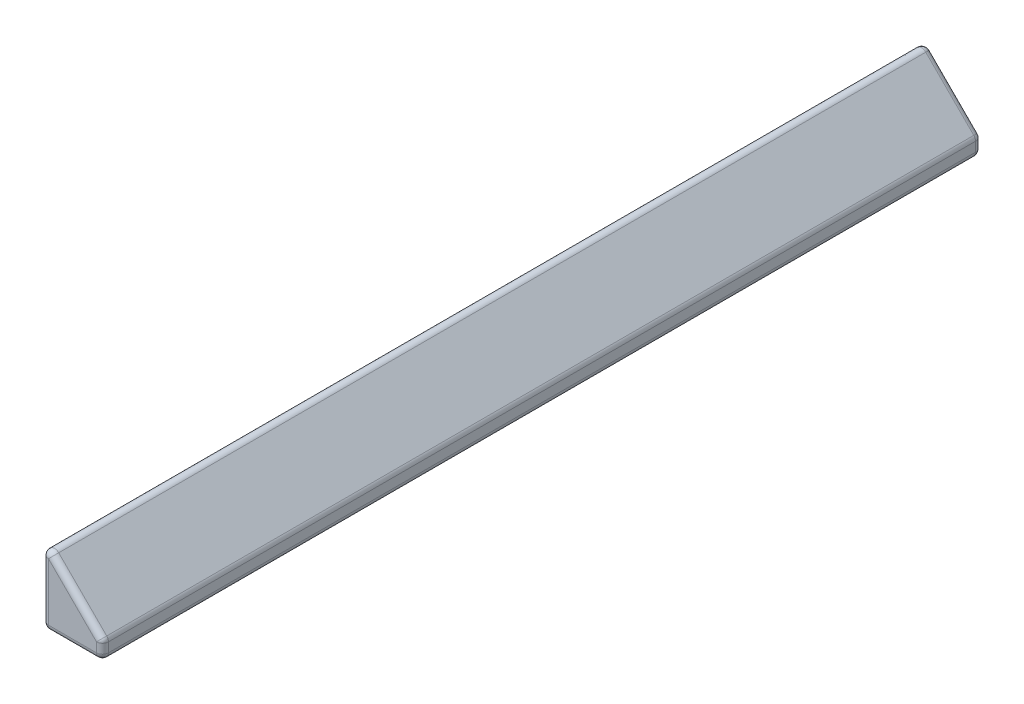
from build123d import *

# Parameters (mm, degrees)
BOSS_EXTRUDE1_DEPTH = 14.65
FILLET1_R           = 0.2


with BuildPart() as part:
    # Sketch1 → Boss-Extrude1 (new, symmetric)
    with BuildSketch(Plane.XY):
        Polygon((0, 2.6), (0, 0), (2, 0), (2, 0.6), align=None)
    extrude(amount=BOSS_EXTRUDE1_DEPTH, both=True)

    # Fillet1
    fillet1_edges = [part.edges().sort_by_distance(p)[0] for p in [
        (0, 2.6, 0),
        (0, 0, 0),
        (2, 0.6, 0),
        (2, 0, 0),
        (2, 0.3, -14.65),
        (1, 1.6, -14.65),
        (0, 1.3, -14.65),
        (1, 0, -14.65),
        (0, 1.3, 14.65),
        (1, 1.6, 14.65),
        (2, 0.3, 14.65),
        (1, 0, 14.65),
    ]]
    fillet(fillet1_edges, radius=FILLET1_R)


solid = part.part
